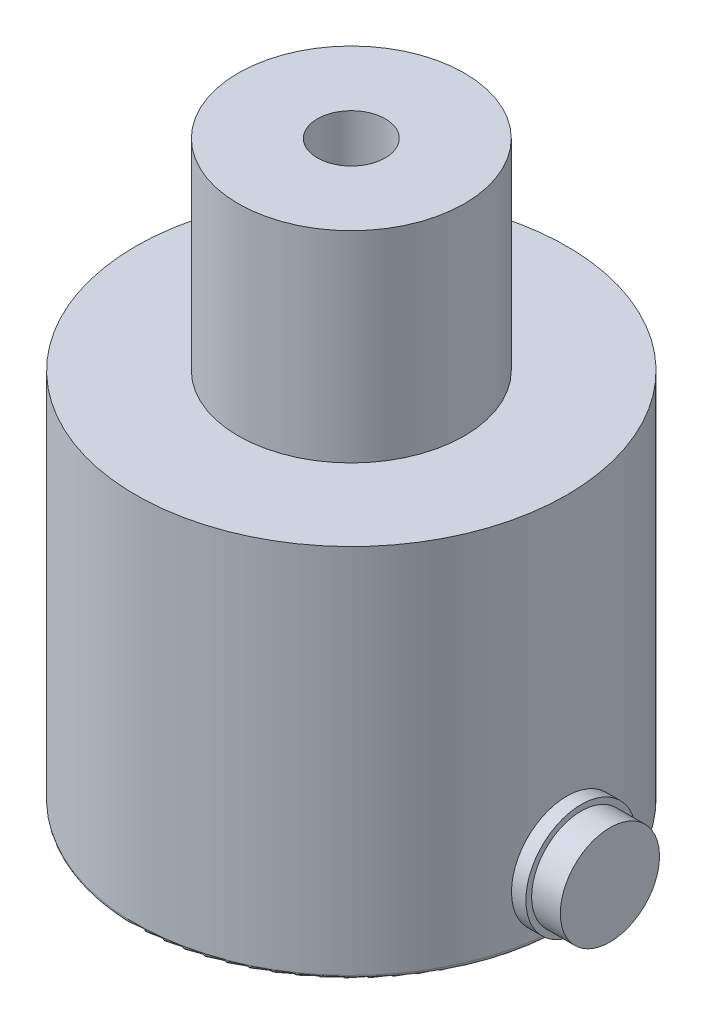
from build123d import *


with BuildPart() as part:
    # Sketch1 → Revolve1 (revolve)
    with BuildSketch(Plane.XY):
        with BuildLine():
            Line((19.05, -6.4405), (19.05, 16.61))
            Line((19.05, 16.61), (10, 16.61))
            Line((10, 16.61), (10, 21.65))
            Line((10, 21.65), (10, 34.39))
            Line((10, 34.39), (3, 34.39))
            Line((3, 34.39), (3, 21.69))
            Line((3, 21.69), (0, 21.69))
            Line((0, 21.69), (0, 0))
            Line((0, 0), (0, -16.61))
            Line((0, -16.61), (18.6595, -16.61))
            ThreePointArc((18.6595, -16.61), (18.935625198, -16.495625198), (19.05, -16.2195))
            Line((19.05, -16.2195), (19.05, -11.33))
            Line((19.05, -11.33), (19.05, -6.4405))
        make_face()
    revolve(axis=Axis((0, 0, 0), (0, 1, 0)))


with BuildPart() as body_2:
    # Sketch1<3> → Revolve2 (revolve)
    with BuildSketch(Plane.XY):
        Polygon((20.32, -6.4405), (19.05, -6.4405), (19.05, -11.33), (22.86, -11.33), (22.86, -6.9485), (20.32, -6.9485), align=None)
    revolve(axis=Axis((19.05, -11.33, 0), (1, 0, 0)))


solid = Compound([part.part, body_2.part])
